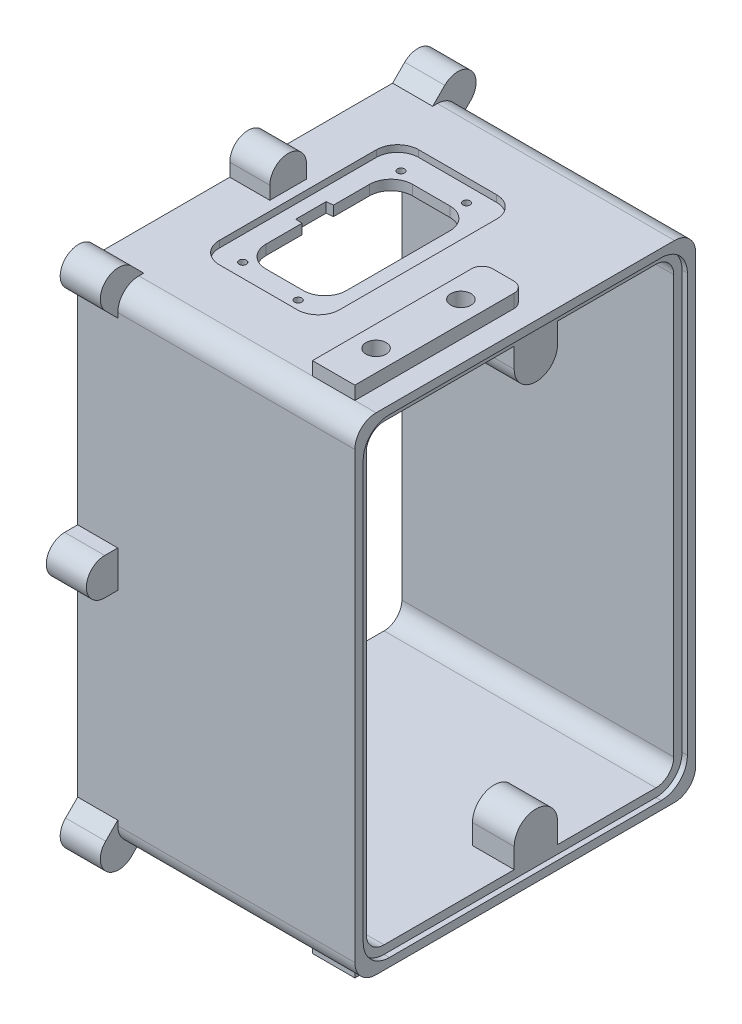
from build123d import *

# Parameters (mm, degrees)
SKETCH1_W               = 92.075
SKETCH1_H               = 135.763
BOSS_EXTRUDE1_DEPTH     = 78
SHELL1_T                = 5
FILLET1_R               = 5.334
FILLET2_R               = 6.35
CUT_EXTRUDE2_DEPTH      = 1.5875
CUT_EXTRUDE3_START      = -5
CUT_EXTRUDE3_DEPTH      = 5
CUT_EXTRUDE4_DEPTH      = 1.2446
FILLET5_R               = 0.254
FILLET6_R               = 0.127
BOSS_EXTRUDE3_DEPTH     = 12.4968
SKETCH17_R              = 3.025
CUT_EXTRUDE9_DEPTH      = 8
BOSS_EXTRUDE4_START     = -12
BOSS_EXTRUDE4_DEPTH     = 12
SKETCH10_R              = 3.025
CUT_EXTRUDE5_DEPTH      = 9
MIRROR4_START           = -12
MIRROR4_COPY_1_DEPTH    = 12
MIRROR4_COPY_2_SKETCH_R = 3.025
MIRROR4_COPY_2_DEPTH    = 9
BOSS_EXTRUDE5_START     = -12
BOSS_EXTRUDE5_DEPTH     = 12
SKETCH12_R              = 3.025
CUT_EXTRUDE6_DEPTH      = 9
CUT_EXTRUDE10_DEPTH     = 2
SKETCH19_W              = 12.7
SKETCH19_H              = 50.8
SKETCH19_R              = 3.025
BOSS_EXTRUDE6_DEPTH     = 4
CUT_EXTRUDE11_START     = -6
SKETCH21_R              = 3.025
CUT_EXTRUDE11_DEPTH     = 6
FILLET7_R               = 3.175
CUT_EXTRUDE12_DEPTH     = 5
BOSS_EXTRUDE7_START     = -12
BOSS_EXTRUDE7_DEPTH     = 12
SKETCH24_R              = 3.025
CUT_EXTRUDE13_DEPTH     = 9


# Read off the part's stored shape, not the designer's step: Boss-Extrude5, Boss-Extrude7
with BuildPart() as part:
    # Sketch1 → Boss-Extrude1 (new body)
    with BuildSketch(Plane(origin=(0, 0, 0), x_dir=(0, 0, -1), z_dir=(1, 0, 0))):
        Rectangle(SKETCH1_W, SKETCH1_H)
    extrude(amount=BOSS_EXTRUDE1_DEPTH)

    # Shell1
    shell1_openings = [part.faces().sort_by_distance(p)[0] for p in [
        (78, 0, 0),
    ]]
    offset(amount=SHELL1_T, openings=shell1_openings, kind=Kind.INTERSECTION)

    # Fillet1
    # the kernel refuses this fillet: 5.334 mm, written as the material it adds along each edge
    with BuildSketch(Plane(origin=(0, -67.8815, -46.0375), x_dir=(0, 0, 1), z_dir=(1, 0, 0)), Plane(origin=(0, 67.8815, -46.0375), x_dir=(0, -1, 0), z_dir=(1, 0, 0)), Plane(origin=(0, 67.8815, 46.0375), x_dir=(0, 0, -1), z_dir=(1, 0, 0))) as fillet1_piece_1:
        with BuildLine():
            CenterArc((FILLET1_R, -FILLET1_R), FILLET1_R, 90, 90)
            Line((0, -FILLET1_R), (0, 0))
            Line((0, 0), (FILLET1_R, 0))
        make_face()
    extrude(amount=78)
    with BuildSketch(Plane(origin=(0, -67.8815, 46.0375), x_dir=(0, 0, -1), z_dir=(1, 0, 0))) as fillet1_piece_2:
        with BuildLine():
            CenterArc((FILLET1_R, FILLET1_R), FILLET1_R, 180, 90)
            Line((0, FILLET1_R), (0, 0))
            Line((0, 0), (FILLET1_R, 0))
        make_face()
    extrude(amount=78)

    # Fillet2
    fillet2_edges = [part.edges().sort_by_distance(p)[0] for p in [
        (36.5, -72.8815, -51.0375),
        (36.5, -72.8815, 51.0375),
        (36.5, 72.8815, 51.0375),
        (36.5, 72.8815, -51.0375),
    ]]
    fillet(fillet2_edges, radius=FILLET2_R)

    # Sketch4 → Cut-Extrude2 (cut)
    with BuildSketch(Plane(origin=(78, 0, 0), x_dir=(0, 0, -1), z_dir=(1, 0, 0))):
        with BuildLine():
            Line((-40.7035, -70.3815), (40.7035, -70.3815))
            ThreePointArc((40.7035, -70.3815), (46.242974524, -68.086974524), (48.5375, -62.5475))
            Line((48.5375, -62.5475), (48.5375, 62.5475))
            ThreePointArc((48.5375, 62.5475), (46.242974524, 68.086974524), (40.7035, 70.3815))
            Line((40.7035, 70.3815), (-40.7035, 70.3815))
            ThreePointArc((-40.7035, 70.3815), (-46.242974524, 68.086974524), (-48.5375, 62.5475))
            Line((-48.5375, 62.5475), (-48.5375, -62.5475))
            ThreePointArc((-48.5375, -62.5475), (-46.242974524, -68.086974524), (-40.7035, -70.3815))
        make_face()
    extrude(amount=-CUT_EXTRUDE2_DEPTH, mode=Mode.SUBTRACT)

    # Sketch5 → Cut-Extrude3 (cut)
    with BuildSketch(Plane(origin=(0, 0, 0), x_dir=(0, 0, -1), z_dir=(1, 0, 0)).offset(CUT_EXTRUDE3_START)):
        with BuildLine():
            Line((40.7035, 67.8815), (-40.7035, 67.8815))
            ThreePointArc((-40.7035, 67.8815), (-44.475207571, 66.319207571), (-46.0375, 62.5475))
            Line((-46.0375, 62.5475), (-46.0375, -62.5475))
            ThreePointArc((-46.0375, -62.5475), (-44.475207571, -66.319207571), (-40.7035, -67.8815))
            Line((-40.7035, -67.8815), (40.7035, -67.8815))
            ThreePointArc((40.7035, -67.8815), (44.475207571, -66.319207571), (46.0375, -62.5475))
            Line((46.0375, -62.5475), (46.0375, 62.5475))
            ThreePointArc((46.0375, 62.5475), (44.475207571, 66.319207571), (40.7035, 67.8815))
        make_face()
    extrude(amount=CUT_EXTRUDE3_DEPTH, mode=Mode.SUBTRACT)

    # Sketch6 → Cut-Extrude4 (cut)
    with BuildSketch(Plane.ZY.offset(5)):
        with BuildLine():
            Line((40.7035, 71.6642), (-40.7035, 71.6642))
            ThreePointArc((-40.7035, 71.6642), (-47.149980392, 68.993980392), (-49.8202, 62.5475))
            Line((-49.8202, 62.5475), (-49.8202, -62.5475))
            ThreePointArc((-49.8202, -62.5475), (-47.149980392, -68.993980392), (-40.7035, -71.6642))
            Line((-40.7035, -71.6642), (40.7035, -71.6642))
            ThreePointArc((40.7035, -71.6642), (47.149980392, -68.993980392), (49.8202, -62.5475))
            Line((49.8202, -62.5475), (49.8202, 62.5475))
            ThreePointArc((49.8202, 62.5475), (47.149980392, 68.993980392), (40.7035, 71.6642))
        make_face()
        with BuildLine():
            Line((-47.2548, 62.5475), (-47.2548, -62.5475))
            ThreePointArc((-47.2548, -62.5475), (-45.335968656, -67.179968656), (-40.7035, -69.0988))
            Line((-40.7035, -69.0988), (40.7035, -69.0988))
            ThreePointArc((40.7035, -69.0988), (45.335968656, -67.179968656), (47.2548, -62.5475))
            Line((47.2548, -62.5475), (47.2548, 62.5475))
            ThreePointArc((47.2548, 62.5475), (45.335968656, 67.179968656), (40.7035, 69.0988))
            Line((40.7035, 69.0988), (-40.7035, 69.0988))
            ThreePointArc((-40.7035, 69.0988), (-45.335968656, 67.179968656), (-47.2548, 62.5475))
        make_face(mode=Mode.SUBTRACT)
    extrude(amount=-CUT_EXTRUDE4_DEPTH, mode=Mode.SUBTRACT)

    # Fillet5
    fillet5_edges = [part.edges().sort_by_distance(p)[0] for p in [
        (-3.7554, 68.993980392, 47.149980392),
        (-3.7554, 0, 49.8202),
        (-3.7554, -68.993980392, 47.149980392),
        (-3.7554, -71.6642, 0),
        (-3.7554, -68.993980392, -47.149980392),
        (-3.7554, 0, -49.8202),
        (-3.7554, 68.993980392, -47.149980392),
        (-3.7554, 71.6642, 0),
        (-3.7554, 69.0988, 0),
        (-3.7554, 67.179968656, -45.335968656),
        (-3.7554, 0, -47.2548),
        (-3.7554, -67.179968656, -45.335968656),
        (-3.7554, -69.0988, 0),
        (-3.7554, -67.179968656, 45.335968656),
        (-3.7554, 0, 47.2548),
        (-3.7554, 67.179968656, 45.335968656),
    ]]
    fillet(fillet5_edges, radius=FILLET5_R)

    # Fillet6
    fillet6_edges = [part.edges().sort_by_distance(p)[0] for p in [
        (-5, 68.993980392, 47.149980392),
        (-5, 71.6642, 0),
        (-5, 68.993980392, -47.149980392),
        (-5, 0, -49.8202),
        (-5, -68.993980392, -47.149980392),
        (-5, -71.6642, 0),
        (-5, -68.993980392, 47.149980392),
        (-5, 0, 49.8202),
        (-5, 67.179968656, -45.335968656),
        (-5, 69.0988, 0),
        (-5, 67.179968656, 45.335968656),
        (-5, 0, 47.2548),
        (-5, -67.179968656, 45.335968656),
        (-5, -69.0988, 0),
        (-5, -67.179968656, -45.335968656),
        (-5, 0, -47.2548),
    ]]
    fillet(fillet6_edges, radius=FILLET6_R)

    # Sketch8 → Boss-Extrude3 (add)
    with BuildSketch(Plane(origin=(63.9157, 0, 0), x_dir=(0, 0, -1), z_dir=(1, 0, 0))):
        with BuildLine():
            Line((-1.7375, -67.8815), (11.2625, -67.8815))
            Line((11.2625, -67.8815), (11.2625, -61.8815))
            ThreePointArc((11.2625, -61.8815), (4.7625, -55.3815), (-1.7375, -61.8815))
            Line((-1.7375, -61.8815), (-1.7375, -67.8815))
        make_face()
    boss_extrude3 = extrude(amount=BOSS_EXTRUDE3_DEPTH)

    # Sketch17 → Cut-Extrude9 (cut)
    with BuildSketch(Plane.ZY.offset(-63.9157)):
        with Locations((-4.7625, -61.8815)):
            Circle(SKETCH17_R)
    cut_extrude9 = extrude(amount=-CUT_EXTRUDE9_DEPTH, mode=Mode.SUBTRACT)

    # Mirror2: Boss-Extrude3, Cut-Extrude9 across plane
    add(boss_extrude3.mirror(Plane.ZX))
    add(cut_extrude9.mirror(Plane.ZX), mode=Mode.SUBTRACT)

    # Sketch9 → Boss-Extrude4 (add)
    with BuildSketch(Plane.ZY.offset(5).offset(BOSS_EXTRUDE4_START)):
        with BuildLine():
            Line((-51.0375, -66.5315), (-51.0375, -65.103325407))
            Line((-51.0375, -65.103325407), (-54.664404156, -68.730229563))
            ThreePointArc((-54.664404156, -68.730229563), (-54.664404156, -76.508404156), (-46.886229563, -76.508404156))
            Line((-46.886229563, -76.508404156), (-43.259325407, -72.8815))
            Line((-43.259325407, -72.8815), (-44.6875, -72.8815))
            ThreePointArc((-44.6875, -72.8815), (-47.117539796, -72.398135031), (-49.177628061, -71.021628061))
            ThreePointArc((-49.177628061, -71.021628061), (-50.554135031, -68.961539796), (-51.0375, -66.5315))
        make_face()
    boss_extrude4 = extrude(amount=BOSS_EXTRUDE4_DEPTH)

    # Sketch10 → Cut-Extrude5 (cut)
    with BuildSketch(Plane.ZY.offset(5)):
        with Locations((-50.775316859, -72.619316859)):
            Circle(SKETCH10_R)
    cut_extrude5 = extrude(amount=-CUT_EXTRUDE5_DEPTH, mode=Mode.SUBTRACT)

    # Mirror3: Boss-Extrude4, Cut-Extrude5 across plane
    add(boss_extrude4.mirror(Plane.XY))
    add(cut_extrude5.mirror(Plane.XY), mode=Mode.SUBTRACT)

    # Mirror4: Boss-Extrude4, Cut-Extrude5 across plane
    add(boss_extrude4.mirror(Plane.ZX))
    add(cut_extrude5.mirror(Plane.ZX), mode=Mode.SUBTRACT)

    # Mirror4 copy 1 sketch → Mirror4 copy 1 (add)
    with BuildSketch(Plane(origin=(-5, 0, 0), x_dir=(0, 0, -1), z_dir=(-1, 0, 0)).offset(MIRROR4_START)):
        with BuildLine():
            Line((-51.0375, -66.5315), (-51.0375, -65.103325407))
            Line((-51.0375, -65.103325407), (-54.664404156, -68.730229563))
            ThreePointArc((-54.664404156, -68.730229563), (-54.664404156, -76.508404156), (-46.886229563, -76.508404156))
            Line((-46.886229563, -76.508404156), (-43.259325407, -72.8815))
            Line((-43.259325407, -72.8815), (-44.6875, -72.8815))
            ThreePointArc((-44.6875, -72.8815), (-47.117539796, -72.398135031), (-49.177628061, -71.021628061))
            ThreePointArc((-49.177628061, -71.021628061), (-50.554135031, -68.961539796), (-51.0375, -66.5315))
        make_face()
    extrude(amount=MIRROR4_COPY_1_DEPTH)

    # Mirror4 copy 2 sketch → Mirror4 copy 2 (cut)
    with BuildSketch(Plane(origin=(-5, 0, 0), x_dir=(0, 0, -1), z_dir=(-1, 0, 0))):
        with Locations((-50.775316859, -72.619316859)):
            Circle(MIRROR4_COPY_2_SKETCH_R)
    extrude(amount=-MIRROR4_COPY_2_DEPTH, mode=Mode.SUBTRACT)

    # Boss-Extrude5 outline → Boss-Extrude5 (add)
    with BuildSketch(Plane.ZY.offset(5).offset(BOSS_EXTRUDE5_START)):
        with BuildLine():
            ThreePointArc((54.9472, -5.5), (60.4472, 0), (54.9472, 5.5))
            Line((54.9472, 5.5), (51.0375, 5.5))
            Line((51.0375, 5.5), (51.0375, -5.5))
            Line((51.0375, -5.5), (54.9472, -5.5))
        make_face()
    boss_extrude5 = extrude(amount=BOSS_EXTRUDE5_DEPTH)

    # Sketch12 → Cut-Extrude6 (cut)
    with BuildSketch(Plane.ZY.offset(5)):
        with Locations((54.9472, 0)):
            Circle(SKETCH12_R)
    cut_extrude6 = extrude(amount=-CUT_EXTRUDE6_DEPTH, mode=Mode.SUBTRACT)

    # Mirror5: Boss-Extrude5, Cut-Extrude6 across plane
    add(boss_extrude5.mirror(Plane.XY))
    add(cut_extrude6.mirror(Plane.XY), mode=Mode.SUBTRACT)

    # Sketch18 → Cut-Extrude10 (cut)
    with BuildSketch(Plane(origin=(0, 72.8815, 0), x_dir=(1, 0, 0), z_dir=(0, 1, 0))):
        with BuildLine():
            Line((16.1741421, -29.781495985), (39.4741421, -29.781495985))
            ThreePointArc((39.4741421, -29.781495985), (43.96427016, -27.921624046), (45.8241421, -23.431495985))
            Line((45.8241421, -23.431495985), (45.8241421, 23.558504015))
            ThreePointArc((45.8241421, 23.558504015), (43.96427016, 28.048632075), (39.4741421, 29.908504015))
            Line((39.4741421, 29.908504015), (16.1741421, 29.908504015))
            ThreePointArc((16.1741421, 29.908504015), (11.684014039, 28.048632075), (9.8241421, 23.558504015))
            Line((9.8241421, 23.558504015), (9.8241421, -23.431495985))
            ThreePointArc((9.8241421, -23.431495985), (11.684014039, -27.921624046), (16.1741421, -29.781495985))
        make_face()
    extrude(amount=-CUT_EXTRUDE10_DEPTH, mode=Mode.SUBTRACT)

    # Sketch19 → Boss-Extrude6 (add)
    with BuildSketch(Plane(origin=(0, 72.8815, 0), x_dir=(1, 0, 0), z_dir=(0, 1, 0))):
        with Locations((65.3, -19.2875)):
            Rectangle(SKETCH19_W, SKETCH19_H)
        with Locations(Location((65.3, -31.9875, 0), (0, 0, 270))):
            Circle(SKETCH19_R, mode=Mode.SUBTRACT)
        with Locations(Location((65.3, -6.5875, 0), (0, 0, 270))):
            Circle(SKETCH19_R, mode=Mode.SUBTRACT)
    boss_extrude6 = extrude(amount=BOSS_EXTRUDE6_DEPTH)

    # Sketch21 → Cut-Extrude11 (cut)
    with BuildSketch(Plane(origin=(0, 76.8815, 0), x_dir=(1, 0, 0), z_dir=(0, 1, 0)).offset(CUT_EXTRUDE11_START)):
        with Locations(Location((65.3, -6.5875, 0), (0, 0, 270))):
            Circle(SKETCH21_R)
        with Locations(Location((65.3, -31.9875, 0), (0, 0, 270))):
            Circle(SKETCH21_R)
    cut_extrude11 = extrude(amount=CUT_EXTRUDE11_DEPTH, mode=Mode.SUBTRACT)

    # Mirror6: Boss-Extrude6, Cut-Extrude11 across plane
    add(boss_extrude6.mirror(Plane.ZX))
    add(cut_extrude11.mirror(Plane.ZX), mode=Mode.SUBTRACT)

    # Fillet7
    fillet7_edges = [part.edges().sort_by_distance(p)[0] for p in [
        (58.95, 74.8815, -6.1125),
        (71.65, 74.8815, -6.1125),
        (58.95, -74.8815, -6.1125),
        (71.65, -74.8815, -6.1125),
    ]]
    fillet(fillet7_edges, radius=FILLET7_R)

    # Sketch22 → Cut-Extrude12 (cut)
    # profile 1 of 7: a face of its own
    with BuildSketch(Plane(origin=(0, 72.8815, 0), x_dir=(1, 0, 0), z_dir=(0, 1, 0))):
        with BuildLine():
            Line((22.224142974, 22.017504253), (33.424142974, 22.017504253))
            ThreePointArc((33.424142974, 22.017504253), (37.98781014, 20.127171419), (39.878142974, 15.563504253))
            Line((39.878142974, 15.563504253), (39.878142974, -15.436495747))
            ThreePointArc((39.878142974, -15.436495747), (37.98781014, -20.000162913), (33.424142974, -21.890495747))
            Line((33.424142974, -21.890495747), (22.224142974, -21.890495747))
            ThreePointArc((22.224142974, -21.890495747), (17.660475808, -20.000162913), (15.770142974, -15.436495747))
            Line((15.770142974, -15.436495747), (15.770142974, -4.669243872))
            Line((15.770142974, -4.669243872), (13.770142804, -4.494266592))
            Line((13.770142804, -4.494266592), (13.770142804, -2.578725006))
            Line((13.770142804, -2.578725006), (15.770142974, -2.403747632))
            Line((15.770142974, -2.403747632), (15.770142974, 2.530756128))
            Line((15.770142974, 2.530756128), (13.770142804, 2.705733408))
            Line((13.770142804, 2.705733408), (13.770142804, 4.621274994))
            Line((13.770142804, 4.621274994), (15.770142974, 4.796252368))
            Line((15.770142974, 4.796252368), (15.770142974, 15.563504253))
            ThreePointArc((15.770142974, 15.563504253), (17.660475808, 20.127171419), (22.224142974, 22.017504253))
        make_face()
        with BuildLine():
            ThreePointArc((22.224142974, 21.763504253), (17.840080931, 19.947566296), (16.024142974, 15.563504253))
            Line((16.024142974, 15.563504253), (16.024142974, 4.563504253))
            Line((16.024142974, 4.563504253), (14.024142804, 4.388526879))
            Line((14.024142804, 4.388526879), (14.024142804, 2.938481534))
            Line((14.024142804, 2.938481534), (16.024142974, 2.763504253))
            Line((16.024142974, 2.763504253), (16.024142974, -2.636495747))
            Line((16.024142974, -2.636495747), (14.024142804, -2.811473121))
            Line((14.024142804, -2.811473121), (14.024142804, -4.261518466))
            Line((14.024142804, -4.261518466), (16.024142974, -4.436495747))
            Line((16.024142974, -4.436495747), (16.024142974, -15.436495747))
            ThreePointArc((16.024142974, -15.436495747), (17.840080931, -19.82055779), (22.224142974, -21.636495747))
            Line((22.224142974, -21.636495747), (33.424142974, -21.636495747))
            ThreePointArc((33.424142974, -21.636495747), (37.808205018, -19.82055779), (39.624142974, -15.436495747))
            Line((39.624142974, -15.436495747), (39.624142974, 15.563504253))
            ThreePointArc((39.624142974, 15.563504253), (37.808205018, 19.947566296), (33.424142974, 21.763504253))
            Line((33.424142974, 21.763504253), (22.224142974, 21.763504253))
        make_face(mode=Mode.SUBTRACT)
    # profile 2 of 7: a face of its own
    with BuildSketch(Plane(origin=(0, 72.8815, 0), x_dir=(1, 0, 0), z_dir=(0, 1, 0))):
        with BuildLine():
            Line((22.224142974, 21.763504253), (33.424142974, 21.763504253))
            ThreePointArc((33.424142974, 21.763504253), (37.808205018, 19.947566296), (39.624142974, 15.563504253))
            Line((39.624142974, 15.563504253), (39.624142974, -15.436495747))
            ThreePointArc((39.624142974, -15.436495747), (37.808205018, -19.82055779), (33.424142974, -21.636495747))
            Line((33.424142974, -21.636495747), (22.224142974, -21.636495747))
            ThreePointArc((22.224142974, -21.636495747), (17.840080931, -19.82055779), (16.024142974, -15.436495747))
            Line((16.024142974, -15.436495747), (16.024142974, -4.436495747))
            Line((16.024142974, -4.436495747), (14.024142804, -4.261518466))
            Line((14.024142804, -4.261518466), (14.024142804, -2.811473121))
            Line((14.024142804, -2.811473121), (16.024142974, -2.636495747))
            Line((16.024142974, -2.636495747), (16.024142974, 2.763504253))
            Line((16.024142974, 2.763504253), (14.024142804, 2.938481534))
            Line((14.024142804, 2.938481534), (14.024142804, 4.388526879))
            Line((14.024142804, 4.388526879), (16.024142974, 4.563504253))
            Line((16.024142974, 4.563504253), (16.024142974, 15.563504253))
            ThreePointArc((16.024142974, 15.563504253), (17.840080931, 19.947566296), (22.224142974, 21.763504253))
        make_face()
    # profile 3 of 7: a face of its own
    with BuildSketch(Plane(origin=(0, 72.8815, 0), x_dir=(1, 0, 0), z_dir=(0, 1, 0))):
        Polygon((13.770142804, -2.578725006), (13.770142804, 2.705733408), (15.770142974, 2.530756128), (15.770142974, -2.403747632), align=None)
    # profile 4 of 7: a face of its own
    with BuildSketch(Plane(origin=(0, 72.8815, 0), x_dir=(1, 0, 0), z_dir=(0, 1, 0))):
        with BuildLine():
            ThreePointArc((17.024142132, 24.848504023), (15.939142132, 23.763504023), (17.024142132, 22.678504023))
            ThreePointArc((17.024142132, 22.678504023), (18.109142132, 23.763504023), (17.024142132, 24.848504023))
        make_face()
    # profile 5 of 7: a face of its own
    with BuildSketch(Plane(origin=(0, 72.8815, 0), x_dir=(1, 0, 0), z_dir=(0, 1, 0))):
        with BuildLine():
            ThreePointArc((35.124142132, 26.348504023), (34.039142132, 25.263504023), (35.124142132, 24.178504023))
            ThreePointArc((35.124142132, 24.178504023), (36.209142132, 25.263504023), (35.124142132, 26.348504023))
        make_face()
    # profile 6 of 7: a face of its own
    with BuildSketch(Plane(origin=(0, 72.8815, 0), x_dir=(1, 0, 0), z_dir=(0, 1, 0))):
        with BuildLine():
            ThreePointArc((17.024142132, -22.551495977), (15.939142132, -23.636495977), (17.024142132, -24.721495977))
            ThreePointArc((17.024142132, -24.721495977), (18.109142132, -23.636495977), (17.024142132, -22.551495977))
        make_face()
    # profile 7 of 7: a face of its own
    with BuildSketch(Plane(origin=(0, 72.8815, 0), x_dir=(1, 0, 0), z_dir=(0, 1, 0))):
        with BuildLine():
            ThreePointArc((35.124142132, -24.051495977), (34.039142132, -25.136495977), (35.124142132, -26.221495977))
            ThreePointArc((35.124142132, -26.221495977), (36.209142132, -25.136495977), (35.124142132, -24.051495977))
        make_face()
    extrude(amount=-CUT_EXTRUDE12_DEPTH, mode=Mode.SUBTRACT)

    # Boss-Extrude7 outline → Boss-Extrude7 (add)
    with BuildSketch(Plane.ZY.offset(5).offset(BOSS_EXTRUDE7_START)):
        with BuildLine():
            Line((-5.5, -72.8815), (-5.5, -76.7912))
            ThreePointArc((-5.5, -76.7912), (0, -82.2912), (5.5, -76.7912))
            Line((5.5, -76.7912), (5.5, -72.8815))
            Line((5.5, -72.8815), (-5.5, -72.8815))
        make_face()
    boss_extrude7 = extrude(amount=BOSS_EXTRUDE7_DEPTH)

    # Sketch24 → Cut-Extrude13 (cut)
    with BuildSketch(Plane.ZY.offset(5)):
        with Locations((0, -76.7912)):
            Circle(SKETCH24_R)
    cut_extrude13 = extrude(amount=-CUT_EXTRUDE13_DEPTH, mode=Mode.SUBTRACT)

    # Mirror7: Boss-Extrude7, Cut-Extrude13 across plane
    add(boss_extrude7.mirror(Plane.ZX))
    add(cut_extrude13.mirror(Plane.ZX), mode=Mode.SUBTRACT)


solid = part.part
